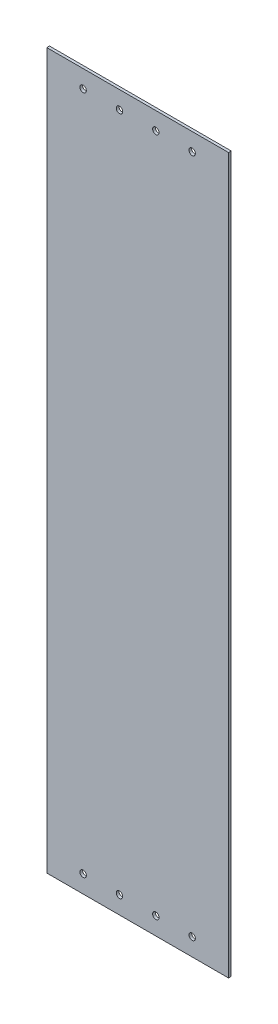
from build123d import *

# Parameters (mm, degrees)
SKETCH1_W            = 155
SKETCH1_H            = 609.6
BOSS_EXTRUDE1_DEPTH  = 2.305
M5_CLEARANCE_HOLE1_D = 5.5


with BuildPart() as part:
    # Sketch1 → Boss-Extrude1 (new body)
    with BuildSketch(Plane.XY):
        Rectangle(SKETCH1_W, SKETCH1_H)
    extrude(amount=BOSS_EXTRUDE1_DEPTH)

    # M5 Clearance Hole1 (through all)
    with Locations(Plane.XY.offset(2.305)):
        with Locations((-46.5, 289.795), (-15.5, 289.795), (15.5, 289.795), (46.5, 289.795), (-46.5, -289.795), (-15.5, -289.795), (15.5, -289.795), (46.5, -289.795)):
            Hole(M5_CLEARANCE_HOLE1_D / 2)


solid = part.part
